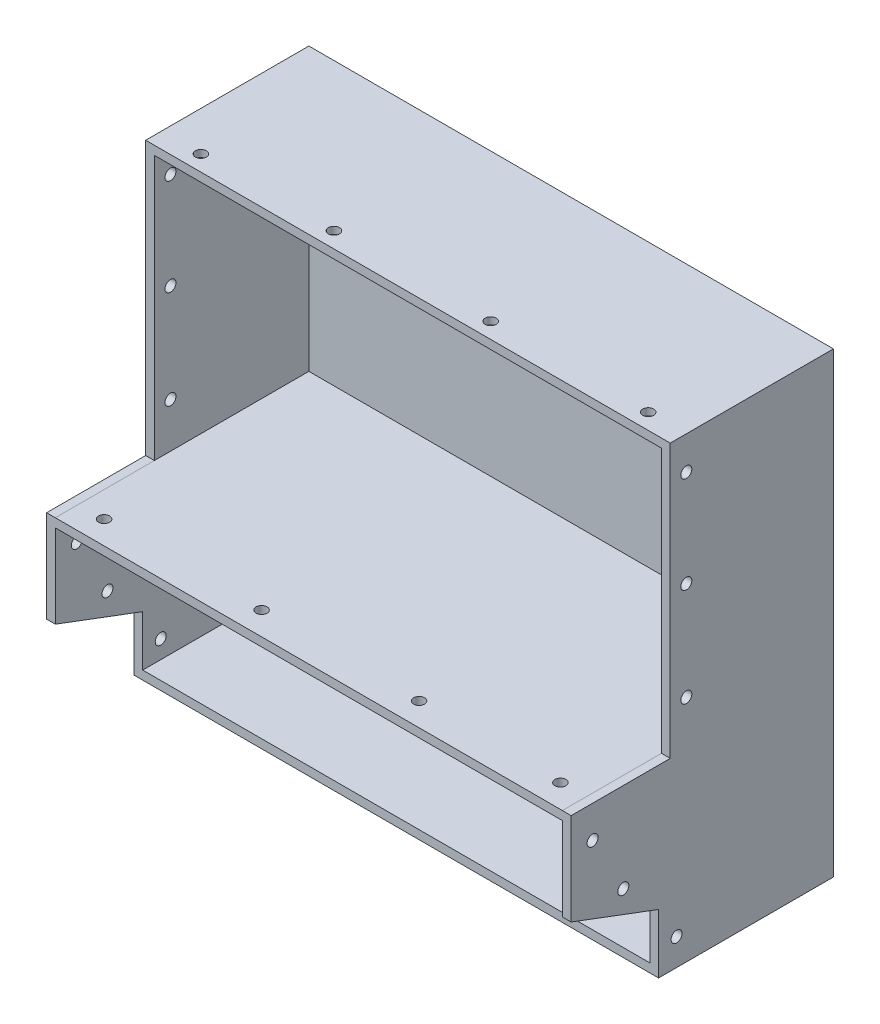
from build123d import *

# Parameters (mm, degrees)
SKETCH1_W           = 190.5
SKETCH1_H           = 166.116
BOSS_EXTRUDE1_DEPTH = 95.25
CUT_EXTRUDE1_DEPTH  = 92.075
CUT_EXTRUDE5_DEPTH  = 35.98418
SKETCH17_W          = 190.5
SKETCH17_H          = 33.474363619
CUT_EXTRUDE6_DEPTH  = 31.75
BOSS_EXTRUDE8_DEPTH = 190.5
SKETCH19_W          = 184.15
SKETCH19_H          = 30.313503047
CUT_EXTRUDE7_DEPTH  = 92.075
SKETCH20_W          = 184.15
SKETCH20_H          = 33.914711244
CUT_EXTRUDE8_DEPTH  = 13.175
CUT_EXTRUDE9_DEPTH  = 60.325
SKETCH23_R          = 2.00000108
CUT_EXTRUDE10_DEPTH = 2.54
SKETCH24_R          = 2
SKETCH24_R_2        = 2.00000108
CUT_EXTRUDE11_DEPTH = 2.54
SKETCH25_R          = 2.00000108
CUT_EXTRUDE12_DEPTH = 229.607619873
SKETCH27_R          = 2.00000108
CUT_EXTRUDE13_DEPTH = 3.175
SKETCH28_R          = 2.00000108
CUT_EXTRUDE15_DEPTH = 229.607619873


with BuildPart() as part:
    # Sketch1 → Boss-Extrude1 (new body)
    with BuildSketch(Plane.XY):
        Rectangle(SKETCH1_W, SKETCH1_H)
    extrude(amount=BOSS_EXTRUDE1_DEPTH)

    # Sketch3 → Cut-Extrude1 (cut)
    with BuildSketch(Plane.XY.offset(95.25)):
        Polygon((83.88326961, 79.883), (-81.085829842, 79.883), (-92.075, 79.883), (-92.075, 32.891702926), (-92.075, -16.095133334), (92.075, -16.095133334), (92.075, 48.662739539), (92.075, 79.883), align=None)
    extrude(amount=-CUT_EXTRUDE1_DEPTH, mode=Mode.SUBTRACT)

    # Sketch15 → Cut-Extrude5 (cut)
    with BuildSketch(Plane.XY.offset(95.25)):
        Polygon((95.25, -16.109272762), (95.25, 83.058), (-95.25, 83.058), (-95.25, -16.109272762), (-92.075, -16.095133334), (-92.075, 79.883), (92.075, 79.883), (92.075, -16.095133334), align=None)
    extrude(amount=-CUT_EXTRUDE5_DEPTH, mode=Mode.SUBTRACT)

    # Sketch17 → Cut-Extrude6 (cut)
    with BuildSketch(Plane.XY.offset(95.25)):
        with Locations((0, -66.320818191)):
            Rectangle(SKETCH17_W, SKETCH17_H)
    extrude(amount=-CUT_EXTRUDE6_DEPTH, mode=Mode.SUBTRACT)

    # Sketch18 → Boss-Extrude8 (add)
    with BuildSketch(Plane.ZY.offset(95.25)):
        Polygon((63.5, -49.583636381), (63.5, -61.506100001), (95.25, -49.583636381), align=None)
    extrude(amount=-BOSS_EXTRUDE8_DEPTH)

    # Sketch19 → Cut-Extrude7 (cut)
    with BuildSketch(Plane.XY.offset(95.25)):
        with Locations((0, -34.426884857)):
            Rectangle(SKETCH19_W, SKETCH19_H)
    extrude(amount=-CUT_EXTRUDE7_DEPTH, mode=Mode.SUBTRACT)

    # Sketch20 → Cut-Extrude8 (cut)
    with BuildSketch(Plane(origin=(0, -74.803163357, 28.08938563), x_dir=(1, 0, 0), z_dir=(0, -0.9361719099317519, 0.3515425366221503))):
        with Locations((0, 54.782261491)):
            Rectangle(SKETCH20_W, SKETCH20_H)
    extrude(amount=-CUT_EXTRUDE8_DEPTH, mode=Mode.SUBTRACT)

    # Sketch21 → Cut-Extrude9 (cut)
    with BuildSketch(Plane.XY.offset(63.5)):
        Polygon((-92.075, -61.506100001), (-92.075, -49.583636381), (92.075, -49.583636381), (92.075, -61.506100001), (92.075, -79.883), (-92.075, -79.883), align=None)
    extrude(amount=-CUT_EXTRUDE9_DEPTH, mode=Mode.SUBTRACT)

    # Sketch23 → Cut-Extrude10 (cut)
    with BuildSketch(Plane.XZ.offset(83.058)):
        with Locations((-82.849188623, 55.000696991)):
            Circle(SKETCH23_R)
        with Locations((-25.472016651, 55.000696991)):
            Circle(SKETCH23_R)
        with Locations((31.523609513, 55.000696991)):
            Circle(SKETCH23_R)
        with Locations((82.814656862, 55.000696991)):
            Circle(SKETCH23_R)
    extrude(amount=-CUT_EXTRUDE10_DEPTH, mode=Mode.SUBTRACT)

    # Sketch24 → Cut-Extrude11 (cut)
    with BuildSketch(Plane(origin=(0, 83.058, 0), x_dir=(1, 0, 0), z_dir=(0, 1, 0))):
        with Locations((81.523328712, -53.55082)):
            Circle(SKETCH24_R)
        with Locations((24.335748782, -53.55082)):
            Circle(SKETCH24_R_2)
        with Locations((-32.590719569, -53.55082)):
            Circle(SKETCH24_R_2)
        with Locations((-80.895203369, -53.55082)):
            Circle(SKETCH24_R_2)
    extrude(amount=-CUT_EXTRUDE11_DEPTH, mode=Mode.SUBTRACT)

    # Sketch25 → Cut-Extrude12 (cut, through all)
    with BuildSketch(Plane(origin=(95.25, 0, 0), x_dir=(0, 0, -1), z_dir=(1, 0, 0))):
        with Locations((-53.42382, 70.993)):
            Circle(SKETCH25_R)
        with Locations((-53.42382, 35.941)):
            Circle(SKETCH25_R)
        with Locations((-53.42382, 0.217760577)):
            Circle(SKETCH25_R)
    extrude(amount=-CUT_EXTRUDE12_DEPTH, mode=Mode.SUBTRACT)

    # Sketch27 → Cut-Extrude13 (cut)
    with BuildSketch(Plane(origin=(0, -16.095133334, 0), x_dir=(1, 0, 0), z_dir=(0, 1, 0))):
        with Locations((82.927784397, -86.822835397)):
            Circle(SKETCH27_R)
        with Locations((31.591922204, -86.822835397)):
            Circle(SKETCH27_R)
        with Locations((-25.602288215, -86.822835397)):
            Circle(SKETCH27_R)
        with Locations((-82.800527943, -86.822835397)):
            Circle(SKETCH27_R)
    extrude(amount=-CUT_EXTRUDE13_DEPTH, mode=Mode.SUBTRACT)

    # Sketch28 → Cut-Extrude15 (cut, through all)
    with BuildSketch(Plane(origin=(95.25, 0, 0), x_dir=(0, 0, -1), z_dir=(1, 0, 0))):
        with Locations((-56.96125, -73.285093297)):
            Circle(SKETCH28_R)
        with Locations((-76.306976382, -48.567809089)):
            Circle(SKETCH28_R)
        with Locations((-87.449753477, -27.794488932)):
            Circle(SKETCH28_R)
    extrude(amount=-CUT_EXTRUDE15_DEPTH, mode=Mode.SUBTRACT)


solid = part.part
